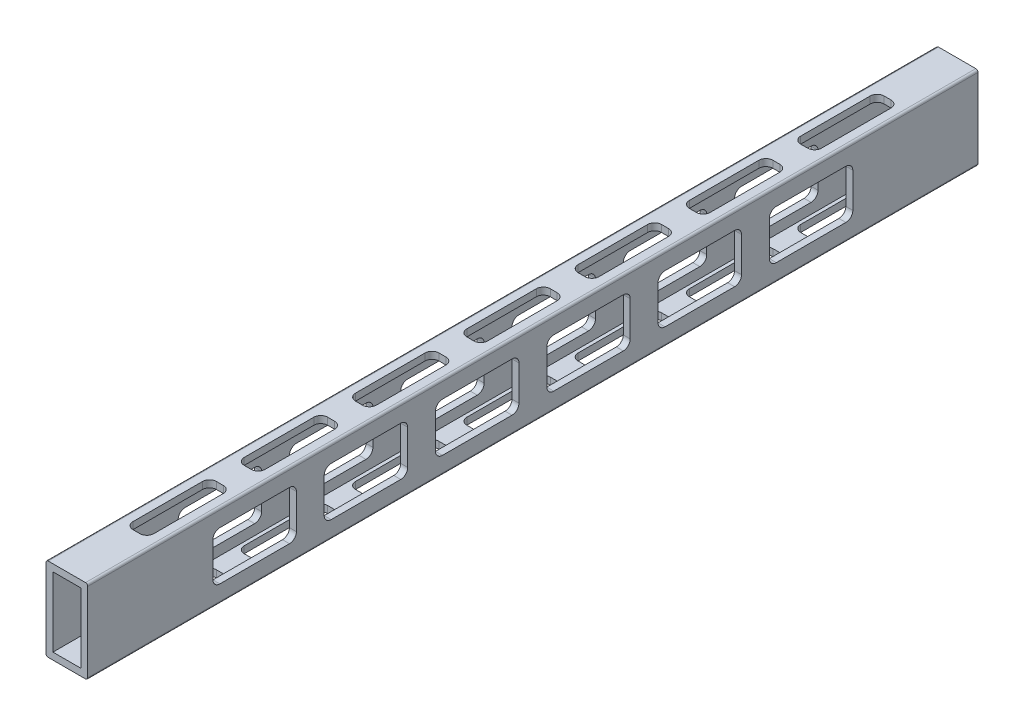
from build123d import *

# Parameters (mm, degrees)
SKETCH1_W               = 12.7
SKETCH1_H               = 31.75
BOSS_EXTRUDE1_DEPTH     = 203.2
CUT_EXTRUDE1_DEPTH      = 207.960323794
CUT_EXTRUDE1_DEPTH_BACK = 207.960323794
CUT_EXTRUDE2_DEPTH      = 205.978157373
CUT_EXTRUDE2_DEPTH_BACK = 205.978157373


with BuildPart() as part:
    # Sketch1 → Boss-Extrude1 (new, symmetric)
    with BuildSketch(Plane.XY):
        with BuildLine():
            Line((-8.525, -19.05), (8.525, -19.05))
            ThreePointArc((8.525, -19.05), (9.232106781, -18.757106781), (9.525, -18.05))
            Line((9.525, -18.05), (9.525, 18.05))
            ThreePointArc((9.525, 18.05), (9.232106781, 18.757106781), (8.525, 19.05))
            Line((8.525, 19.05), (-8.525, 19.05))
            ThreePointArc((-8.525, 19.05), (-9.232106781, 18.757106781), (-9.525, 18.05))
            Line((-9.525, 18.05), (-9.525, -18.05))
            ThreePointArc((-9.525, -18.05), (-9.232106781, -18.757106781), (-8.525, -19.05))
        make_face()
        Rectangle(SKETCH1_W, SKETCH1_H, mode=Mode.SUBTRACT)
    extrude(amount=BOSS_EXTRUDE1_DEPTH, both=True)

    # Sketch2 → Cut-Extrude1 (cut, two sides: drawn at the far end of the back side and taken through both)
    with BuildSketch(Plane(origin=(0, 19.05, 0), x_dir=(1, 0, 0), z_dir=(0, 1, 0)).offset(-CUT_EXTRUDE1_DEPTH_BACK)):
        with BuildLine():
            Line((-4.7625, -117.475), (-4.7625, -85.725))
            ThreePointArc((-4.7625, -85.725), (-3.83256403, -83.47993597), (-1.5875, -82.55))
            Line((-1.5875, -82.55), (1.5875, -82.55))
            ThreePointArc((1.5875, -82.55), (3.83256403, -83.47993597), (4.7625, -85.725))
            Line((4.7625, -85.725), (4.7625, -117.475))
            ThreePointArc((4.7625, -117.475), (3.83256403, -119.72006403), (1.5875, -120.65))
            Line((1.5875, -120.65), (-1.5875, -120.65))
            ThreePointArc((-1.5875, -120.65), (-3.83256403, -119.72006403), (-4.7625, -117.475))
        make_face()
        with BuildLine():
            Line((-1.5875, -171.45), (1.5875, -171.45))
            ThreePointArc((1.5875, -171.45), (3.83256403, -170.52006403), (4.7625, -168.275))
            Line((4.7625, -168.275), (4.7625, -136.525))
            ThreePointArc((4.7625, -136.525), (3.83256403, -134.27993597), (1.5875, -133.35))
            Line((1.5875, -133.35), (-1.5875, -133.35))
            ThreePointArc((-1.5875, -133.35), (-3.83256403, -134.27993597), (-4.7625, -136.525))
            Line((-4.7625, -136.525), (-4.7625, -168.275))
            ThreePointArc((-4.7625, -168.275), (-3.83256403, -170.52006403), (-1.5875, -171.45))
        make_face()
        with BuildLine():
            Line((-4.7625, -66.675), (-4.7625, -34.925))
            ThreePointArc((-4.7625, -34.925), (-3.83256403, -32.67993597), (-1.5875, -31.75))
            Line((-1.5875, -31.75), (1.5875, -31.75))
            ThreePointArc((1.5875, -31.75), (3.83256403, -32.67993597), (4.7625, -34.925))
            Line((4.7625, -34.925), (4.7625, -66.675))
            ThreePointArc((4.7625, -66.675), (3.83256403, -68.92006403), (1.5875, -69.85))
            Line((1.5875, -69.85), (-1.5875, -69.85))
            ThreePointArc((-1.5875, -69.85), (-3.83256403, -68.92006403), (-4.7625, -66.675))
        make_face()
        with BuildLine():
            Line((-4.7625, -15.875), (-4.7625, 15.875))
            ThreePointArc((-4.7625, 15.875), (-3.83256403, 18.12006403), (-1.5875, 19.05))
            Line((-1.5875, 19.05), (1.5875, 19.05))
            ThreePointArc((1.5875, 19.05), (3.83256403, 18.12006403), (4.7625, 15.875))
            Line((4.7625, 15.875), (4.7625, -15.875))
            ThreePointArc((4.7625, -15.875), (3.83256403, -18.12006403), (1.5875, -19.05))
            Line((1.5875, -19.05), (-1.5875, -19.05))
            ThreePointArc((-1.5875, -19.05), (-3.83256403, -18.12006403), (-4.7625, -15.875))
        make_face()
        with BuildLine():
            Line((-4.7625, 34.925), (-4.7625, 66.675))
            ThreePointArc((-4.7625, 66.675), (-3.83256403, 68.92006403), (-1.5875, 69.85))
            Line((-1.5875, 69.85), (1.5875, 69.85))
            ThreePointArc((1.5875, 69.85), (3.83256403, 68.92006403), (4.7625, 66.675))
            Line((4.7625, 66.675), (4.7625, 34.925))
            ThreePointArc((4.7625, 34.925), (3.83256403, 32.67993597), (1.5875, 31.75))
            Line((1.5875, 31.75), (-1.5875, 31.75))
            ThreePointArc((-1.5875, 31.75), (-3.83256403, 32.67993597), (-4.7625, 34.925))
        make_face()
        with BuildLine():
            Line((-4.7625, 85.725), (-4.7625, 117.475))
            ThreePointArc((-4.7625, 117.475), (-3.83256403, 119.72006403), (-1.5875, 120.65))
            Line((-1.5875, 120.65), (1.5875, 120.65))
            ThreePointArc((1.5875, 120.65), (3.83256403, 119.72006403), (4.7625, 117.475))
            Line((4.7625, 117.475), (4.7625, 85.725))
            ThreePointArc((4.7625, 85.725), (3.83256403, 83.47993597), (1.5875, 82.55))
            Line((1.5875, 82.55), (-1.5875, 82.55))
            ThreePointArc((-1.5875, 82.55), (-3.83256403, 83.47993597), (-4.7625, 85.725))
        make_face()
        with BuildLine():
            Line((-4.7625, 136.525), (-4.7625, 168.275))
            ThreePointArc((-4.7625, 168.275), (-3.83256403, 170.52006403), (-1.5875, 171.45))
            Line((-1.5875, 171.45), (1.5875, 171.45))
            ThreePointArc((1.5875, 171.45), (3.83256403, 170.52006403), (4.7625, 168.275))
            Line((4.7625, 168.275), (4.7625, 136.525))
            ThreePointArc((4.7625, 136.525), (3.83256403, 134.27993597), (1.5875, 133.35))
            Line((1.5875, 133.35), (-1.5875, 133.35))
            ThreePointArc((-1.5875, 133.35), (-3.83256403, 134.27993597), (-4.7625, 136.525))
        make_face()
    extrude(amount=CUT_EXTRUDE1_DEPTH + CUT_EXTRUDE1_DEPTH_BACK, mode=Mode.SUBTRACT)

    # Sketch3 → Cut-Extrude2 (cut, two sides: drawn at the far end of the back side and taken through both)
    with BuildSketch(Plane(origin=(9.525, 0, 0), x_dir=(0, 0, -1), z_dir=(1, 0, 0)).offset(-CUT_EXTRUDE2_DEPTH_BACK)):
        with BuildLine():
            Line((-95.25, -7.9375), (-95.25, 7.9375))
            ThreePointArc((-95.25, 7.9375), (-94.32006403, 10.18256403), (-92.075, 11.1125))
            Line((-92.075, 11.1125), (-60.325, 11.1125))
            ThreePointArc((-60.325, 11.1125), (-58.07993597, 10.18256403), (-57.15, 7.9375))
            Line((-57.15, 7.9375), (-57.15, -7.9375))
            ThreePointArc((-57.15, -7.9375), (-58.07993597, -10.18256403), (-60.325, -11.1125))
            Line((-60.325, -11.1125), (-92.075, -11.1125))
            ThreePointArc((-92.075, -11.1125), (-94.32006403, -10.18256403), (-95.25, -7.9375))
        make_face()
        with BuildLine():
            Line((-142.875, -11.1125), (-111.125, -11.1125))
            ThreePointArc((-111.125, -11.1125), (-108.87993597, -10.18256403), (-107.95, -7.9375))
            Line((-107.95, -7.9375), (-107.95, 7.9375))
            ThreePointArc((-107.95, 7.9375), (-108.87993597, 10.18256403), (-111.125, 11.1125))
            Line((-111.125, 11.1125), (-142.875, 11.1125))
            ThreePointArc((-142.875, 11.1125), (-145.12006403, 10.18256403), (-146.05, 7.9375))
            Line((-146.05, 7.9375), (-146.05, -7.9375))
            ThreePointArc((-146.05, -7.9375), (-145.12006403, -10.18256403), (-142.875, -11.1125))
        make_face()
        with BuildLine():
            Line((-44.45, -7.9375), (-44.45, 7.9375))
            ThreePointArc((-44.45, 7.9375), (-43.52006403, 10.18256403), (-41.275, 11.1125))
            Line((-41.275, 11.1125), (-9.525, 11.1125))
            ThreePointArc((-9.525, 11.1125), (-7.27993597, 10.18256403), (-6.35, 7.9375))
            Line((-6.35, 7.9375), (-6.35, -7.9375))
            ThreePointArc((-6.35, -7.9375), (-7.27993597, -10.18256403), (-9.525, -11.1125))
            Line((-9.525, -11.1125), (-41.275, -11.1125))
            ThreePointArc((-41.275, -11.1125), (-43.52006403, -10.18256403), (-44.45, -7.9375))
        make_face()
        with BuildLine():
            Line((6.35, -7.9375), (6.35, 7.9375))
            ThreePointArc((6.35, 7.9375), (7.27993597, 10.18256403), (9.525, 11.1125))
            Line((9.525, 11.1125), (41.275, 11.1125))
            ThreePointArc((41.275, 11.1125), (43.52006403, 10.18256403), (44.45, 7.9375))
            Line((44.45, 7.9375), (44.45, -7.9375))
            ThreePointArc((44.45, -7.9375), (43.52006403, -10.18256403), (41.275, -11.1125))
            Line((41.275, -11.1125), (9.525, -11.1125))
            ThreePointArc((9.525, -11.1125), (7.27993597, -10.18256403), (6.35, -7.9375))
        make_face()
        with BuildLine():
            Line((57.15, -7.9375), (57.15, 7.9375))
            ThreePointArc((57.15, 7.9375), (58.07993597, 10.18256403), (60.325, 11.1125))
            Line((60.325, 11.1125), (92.075, 11.1125))
            ThreePointArc((92.075, 11.1125), (94.32006403, 10.18256403), (95.25, 7.9375))
            Line((95.25, 7.9375), (95.25, -7.9375))
            ThreePointArc((95.25, -7.9375), (94.32006403, -10.18256403), (92.075, -11.1125))
            Line((92.075, -11.1125), (60.325, -11.1125))
            ThreePointArc((60.325, -11.1125), (58.07993597, -10.18256403), (57.15, -7.9375))
        make_face()
        with BuildLine():
            Line((107.95, -7.9375), (107.95, 7.9375))
            ThreePointArc((107.95, 7.9375), (108.87993597, 10.18256403), (111.125, 11.1125))
            Line((111.125, 11.1125), (142.875, 11.1125))
            ThreePointArc((142.875, 11.1125), (145.12006403, 10.18256403), (146.05, 7.9375))
            Line((146.05, 7.9375), (146.05, -7.9375))
            ThreePointArc((146.05, -7.9375), (145.12006403, -10.18256403), (142.875, -11.1125))
            Line((142.875, -11.1125), (111.125, -11.1125))
            ThreePointArc((111.125, -11.1125), (108.87993597, -10.18256403), (107.95, -7.9375))
        make_face()
    extrude(amount=CUT_EXTRUDE2_DEPTH + CUT_EXTRUDE2_DEPTH_BACK, mode=Mode.SUBTRACT)


solid = part.part
